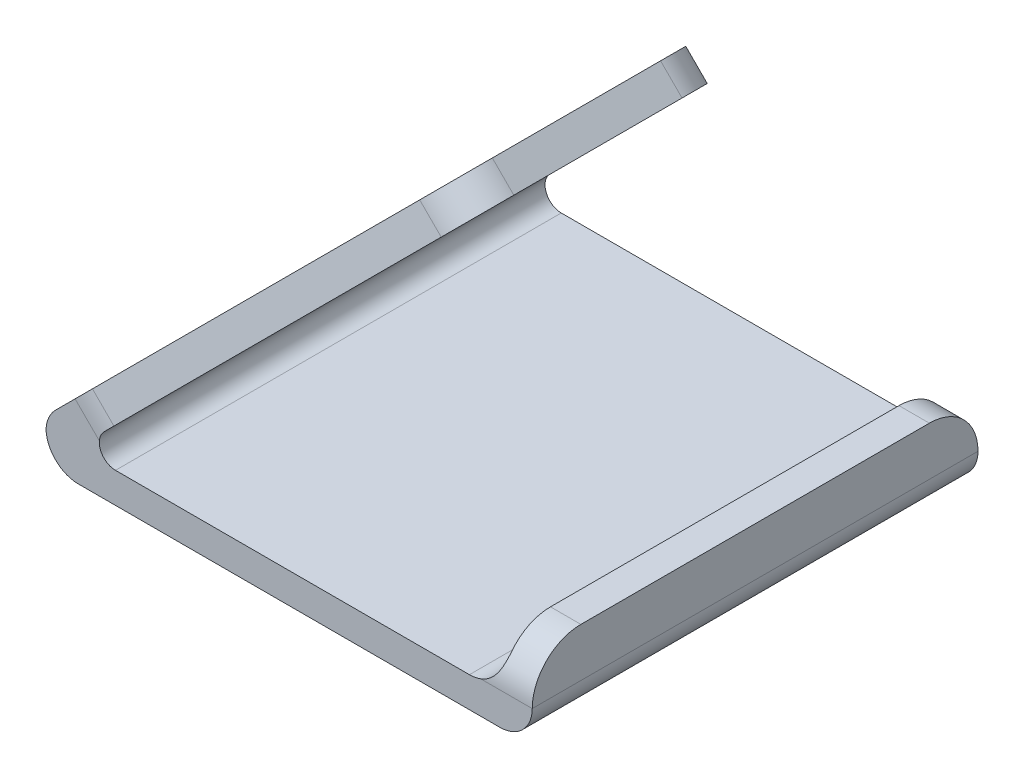
from build123d import *

# Parameters (mm, degrees)
BOSS_EXTRUDE1_DEPTH = 69.85
FILLET1_R           = 5.08
FILLET3_R           = 2.54
CUT_EXTRUDE1_REACH  = 93.204
FILLET2_R           = 7.62
FILLET4_R           = 12.7


with BuildPart() as part:
    # Sketch1 → Boss-Extrude1 (new body)
    with BuildSketch(Plane.XY):
        Polygon((-76.2, 6.735192091), (-27.998371742, 54.936820349), (-24.630775696, 51.569224304), (-71.4375, 4.7625), (-4.7625, 4.7625), (-4.7625, 12.7), (0, 12.7), (0, 6.630240755), (0, 0), (-76.2, 0), align=None)
    extrude(amount=BOSS_EXTRUDE1_DEPTH)

    # Fillet1
    # the kernel refuses this fillet: 5.08 mm, written as the material it adds along each edge
    with BuildSketch(Plane(origin=(-4.7625, 4.7625, 0), x_dir=(0, 1, 0), z_dir=(0, 0, 1))) as fillet1_piece_1:
        with BuildLine():
            CenterArc((FILLET1_R, FILLET1_R), FILLET1_R, 180, 90)
            Line((0, FILLET1_R), (0, 0))
            Line((0, 0), (FILLET1_R, 0))
        make_face()
    extrude(amount=69.85)
    # the kernel refuses this fillet: 5.08 mm, written as the material it takes off along each edge
    with BuildSketch(Plane(origin=(-76.2, 0, -12.7), x_dir=(0, 1, 0), z_dir=(0, 0, 1)), Plane(origin=(0, 0, -12.7), x_dir=(-1, 0, 0), z_dir=(0, 0, 1))) as fillet1_2_piece_1:
        with BuildLine():
            CenterArc((FILLET1_R, -FILLET1_R), FILLET1_R, 90, 90)
            Line((0, -FILLET1_R), (0, 0))
            Line((0, 0), (FILLET1_R, 0))
        make_face()
    extrude(amount=95.25, mode=Mode.SUBTRACT)
    with BuildSketch(Plane(origin=(-76.2, 6.735192091, -5.260512242), x_dir=(0.7071067811865465, 0.7071067811865486, 0), z_dir=(0, 0, 1))) as fillet1_2_piece_2:
        with BuildLine():
            CenterArc((FILLET1_R * 0.414213562373, -FILLET1_R), FILLET1_R, 90, 45)
            Line((-FILLET1_R * 0.292893218813, -FILLET1_R * 0.292893218813), (0, 0))
            Line((0, 0), (FILLET1_R * 0.414213562373, 0))
        make_face()
    extrude(amount=80.371024484, mode=Mode.SUBTRACT)

    # Fillet3
    fillet3_edges = [part.edges().sort_by_distance(p)[0] for p in [
        (-71.4375, 4.7625, 34.925),
    ]]
    fillet(fillet3_edges, radius=FILLET3_R)

    # Sketch2 → Cut-Extrude1 (cut, up to next)
    with BuildSketch(Plane(origin=(-41.467596045, 41.467596045, 0), x_dir=(0, 0, 1), z_dir=(-0.7071067811865489, 0.7071067811865462, 0)), mode=Mode.PRIVATE) as cut_extrude1_sk1:
        Polygon((15.875, 19.048359685), (0, -41.014242187), (0, 19.048359685), align=None)
    cut_extrude1_tool1 = extrude(cut_extrude1_sk1.sketch, amount=-CUT_EXTRUDE1_REACH, mode=Mode.PRIVATE) & part.part
    # Sketch2 → Cut-Extrude1 (cut, up to next)
    with BuildSketch(Plane(origin=(-41.467596045, 41.467596045, 0), x_dir=(0, 0, 1), z_dir=(-0.7071067811865489, 0.7071067811865462, 0)), mode=Mode.PRIVATE) as cut_extrude1_sk2:
        Polygon((69.85, 19.048359685), (53.975, 19.048359685), (69.85, -41.014242187), align=None)
    cut_extrude1_tool2 = extrude(cut_extrude1_sk2.sketch, amount=-CUT_EXTRUDE1_REACH, mode=Mode.PRIVATE) & part.part
    add(cut_extrude1_tool1.solids().sort_by_distance((-42.155263, 40.779929, 5.291667))[0], mode=Mode.SUBTRACT)
    add(cut_extrude1_tool2.solids().sort_by_distance((-42.155263, 40.779929, 64.558333))[0], mode=Mode.SUBTRACT)

    # Fillet2
    fillet2_edges = [part.edges().sort_by_distance(p)[0] for p in [
        (-2.38125, 12.7, 0),
        (-2.38125, 12.7, 69.85),
        (-26.314573719, 53.253022326, 53.975),
        (-26.314573719, 53.253022326, 15.875),
    ]]
    fillet(fillet2_edges, radius=FILLET2_R)

    # Fillet4
    fillet4_edges = [part.edges().sort_by_distance(p)[0] for p in [
        (-68.785246798, 10.782349247, 0),
        (-68.785246798, 10.782349247, 69.85),
    ]]
    fillet(fillet4_edges, radius=FILLET4_R)


solid = part.part
